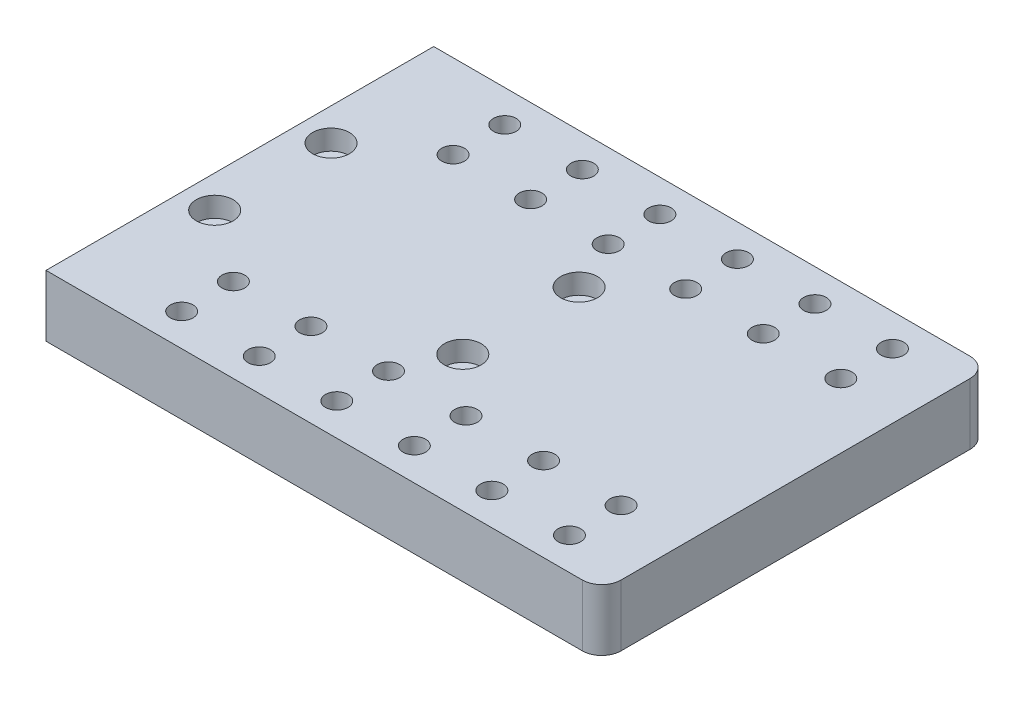
from build123d import *

# Parameters (mm, degrees)
SKETCH_1_W             = 86
SKETCH_1_H             = 60
EXTRUDE_1_DEPTH        = 9.5
FILLET_1_R             = 3
SKETCH_2_R             = 1.25
CUT_EXTRUDE_1_DEPTH    = 54.284613164
SKETCH_3_R             = 2.85
CUT_EXTRUDE_2_DEPTH    = 3.1
SKETCH_4_R             = 1.75
CUT_EXTRUDE_3_DEPTH    = 54.284613164
PATTERN_LINEAR_1_COUNT = 6
PATTERN_LINEAR_1_PITCH = 12


with BuildPart() as part:
    # 草图1 → 凸台-拉伸1 (new body)
    with BuildSketch(Plane(origin=(0, 0, 0), x_dir=(1, 0, 0), z_dir=(0, 1, 0))):
        Rectangle(SKETCH_1_W, SKETCH_1_H)
    extrude(amount=EXTRUDE_1_DEPTH)

    # 圆角1
    fillet_1_edges = [part.edges().sort_by_distance(p)[0] for p in [
        (43, 4.75, -30),
        (43, 4.75, 30),
    ]]
    fillet(fillet_1_edges, radius=FILLET_1_R)

    # 草图2 → 切除-拉伸1 (cut, through all)
    with BuildSketch(Plane(origin=(0, 9.5, 0), x_dir=(1, 0, 0), z_dir=(0, 1, 0))):
        with Locations((-38, -8.88983487)):
            Circle(SKETCH_2_R)
        with Locations((-38, 9.11016513)):
            Circle(SKETCH_2_R)
        with Locations((0.5, 9)):
            Circle(SKETCH_2_R)
        with Locations((0.5, -9)):
            Circle(SKETCH_2_R)
    extrude(amount=-CUT_EXTRUDE_1_DEPTH, mode=Mode.SUBTRACT)

    # 草图3 → 切除-拉伸2 (cut)
    with BuildSketch(Plane(origin=(0, 9.5, 0), x_dir=(1, 0, 0), z_dir=(0, 1, 0))):
        with Locations((-38, -8.88983487)):
            Circle(SKETCH_3_R)
        with Locations((-38, 9.11016513)):
            Circle(SKETCH_3_R)
        with Locations((0.5, -9)):
            Circle(SKETCH_3_R)
        with Locations((0.5, 9)):
            Circle(SKETCH_3_R)
    extrude(amount=-CUT_EXTRUDE_2_DEPTH, mode=Mode.SUBTRACT)

    # 草图4 → 切除-拉伸3 (cut, through all)
    with BuildSketch(Plane(origin=(0, 9.5, 0), x_dir=(1, 0, 0), z_dir=(0, 1, 0))):
        with Locations((-27, -25)):
            Circle(SKETCH_4_R)
        with Locations((-27, 25)):
            Circle(SKETCH_4_R)
        with Locations((-27, -17)):
            Circle(SKETCH_4_R)
        with Locations((-27, 17)):
            Circle(SKETCH_4_R)
    cut_extrude_3 = extrude(amount=-CUT_EXTRUDE_3_DEPTH, mode=Mode.SUBTRACT)

    # 阵列(线性)1: 切除-拉伸3 ×6
    with Locations(*[(i * PATTERN_LINEAR_1_PITCH, 0, 0) for i in range(1, PATTERN_LINEAR_1_COUNT)]):
        add(cut_extrude_3, mode=Mode.SUBTRACT)


solid = part.part
